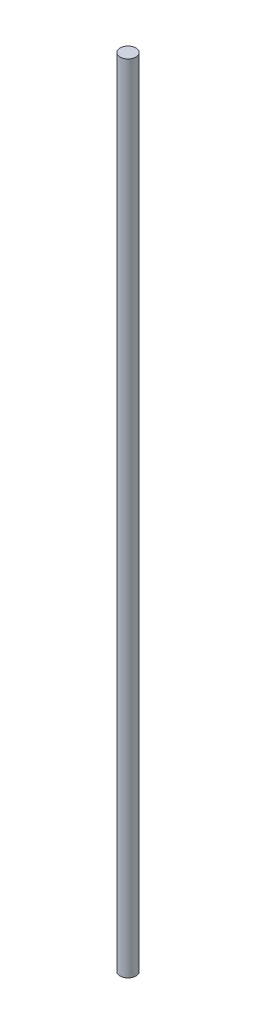
from build123d import *

# Parameters (mm, degrees)
SKETCH1_R           = 4
BOSS_EXTRUDE1_DEPTH = 400


with BuildPart() as part:
    # Sketch1 → Boss-Extrude1 (new body)
    with BuildSketch(Plane(origin=(0, 0, 0), x_dir=(1, 0, 0), z_dir=(0, 1, 0))):
        Circle(SKETCH1_R)
    extrude(amount=-BOSS_EXTRUDE1_DEPTH)


solid = part.part
